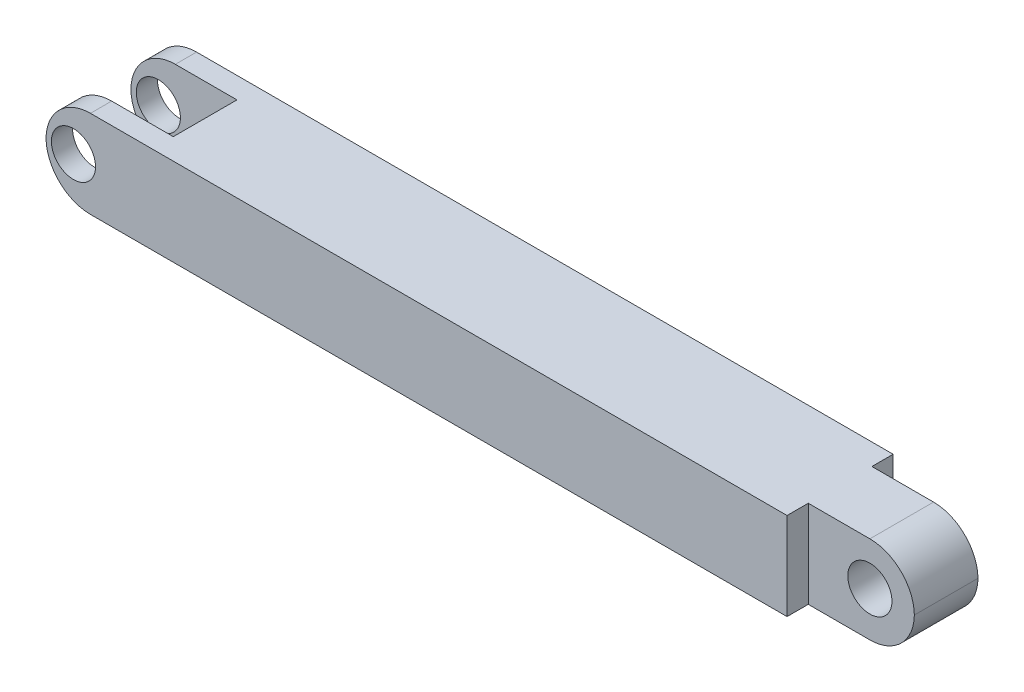
from build123d import *

# Parameters (mm, degrees)
BOSS_EXTRUDE1_DEPTH = 8.255
FILLET1_R           = 4.191
SKETCH2_R           = 2.07899
CUT_EXTRUDE1_DEPTH  = 81.896006892
FILLET2_R           = 4.191
SKETCH3_R           = 2.07899
CUT_EXTRUDE2_DEPTH  = 8.255


with BuildPart() as part:
    # Sketch1 → Boss-Extrude1 (new body)
    with BuildSketch(Plane(origin=(0, 0, 0), x_dir=(1, 0, 0), z_dir=(0, 1, 0))):
        Polygon((69.85, -7.99998), (69.85, -9.99998), (0, -9.99998), (0, -8.001), (9.99998, -8.001), (9.99998, -1.99898), (0, -1.99898), (0, 0), (69.85, 0), (69.85, -2), (79.84998, -2), (79.84998, -7.99998), align=None)
    extrude(amount=BOSS_EXTRUDE1_DEPTH)

    # Fillet1
    # the kernel refuses this fillet: 4.191 mm, written as the material it takes off along each edge
    with BuildSketch(Plane(origin=(0, 0, 12.47648), x_dir=(0, 1, 0), z_dir=(0, 0, -1)), Plane(origin=(0, 0, 20.47748), x_dir=(0, 1, 0), z_dir=(0, 0, -1))) as fillet1_piece_1:
        with BuildLine():
            CenterArc((FILLET1_R, FILLET1_R), FILLET1_R, 180, 90)
            Line((0, FILLET1_R), (0, 0))
            Line((0, 0), (FILLET1_R, 0))
        make_face()
    extrude(amount=22.95398, mode=Mode.SUBTRACT)
    with BuildSketch(Plane(origin=(0, 8.255, 12.47648), x_dir=(0, -1, 0), z_dir=(0, 0, -1)), Plane(origin=(0, 8.255, 20.47748), x_dir=(0, -1, 0), z_dir=(0, 0, -1))) as fillet1_piece_2:
        with BuildLine():
            CenterArc((FILLET1_R, -FILLET1_R), FILLET1_R, 90, 90)
            Line((0, -FILLET1_R), (0, 0))
            Line((0, 0), (FILLET1_R, 0))
        make_face()
    extrude(amount=22.95398, mode=Mode.SUBTRACT)

    # Sketch2 → Cut-Extrude1 (cut, through all)
    with BuildSketch(Plane.XY.offset(9.99998)):
        with Locations((2.587471088, 4.1275)):
            Circle(SKETCH2_R)
    extrude(amount=-CUT_EXTRUDE1_DEPTH, mode=Mode.SUBTRACT)

    # Fillet2
    # the kernel refuses this fillet: 4.191 mm, written as the material it takes off along each edge
    with BuildSketch(Plane(origin=(79.84998, 0, -8.4775), x_dir=(-1, 0, 0), z_dir=(0, 0, 1))) as fillet2_piece_1:
        with BuildLine():
            CenterArc((FILLET2_R, -FILLET2_R), FILLET2_R, 90, 90)
            Line((0, -FILLET2_R), (0, 0))
            Line((0, 0), (FILLET2_R, 0))
        make_face()
    extrude(amount=26.95498, mode=Mode.SUBTRACT)
    with BuildSketch(Plane(origin=(79.84998, 8.255, -8.4775), x_dir=(-1, 0, 0), z_dir=(0, 0, 1))) as fillet2_piece_2:
        with BuildLine():
            CenterArc((FILLET2_R, FILLET2_R), FILLET2_R, 180, 90)
            Line((0, FILLET2_R), (0, 0))
            Line((0, 0), (FILLET2_R, 0))
        make_face()
    extrude(amount=26.95498, mode=Mode.SUBTRACT)

    # Sketch3 → Cut-Extrude2 (cut)
    with BuildSketch(Plane.XY.offset(7.99998)):
        with Locations((75.65898, 4.191)):
            Circle(SKETCH3_R)
    extrude(amount=-CUT_EXTRUDE2_DEPTH, mode=Mode.SUBTRACT)


solid = part.part
